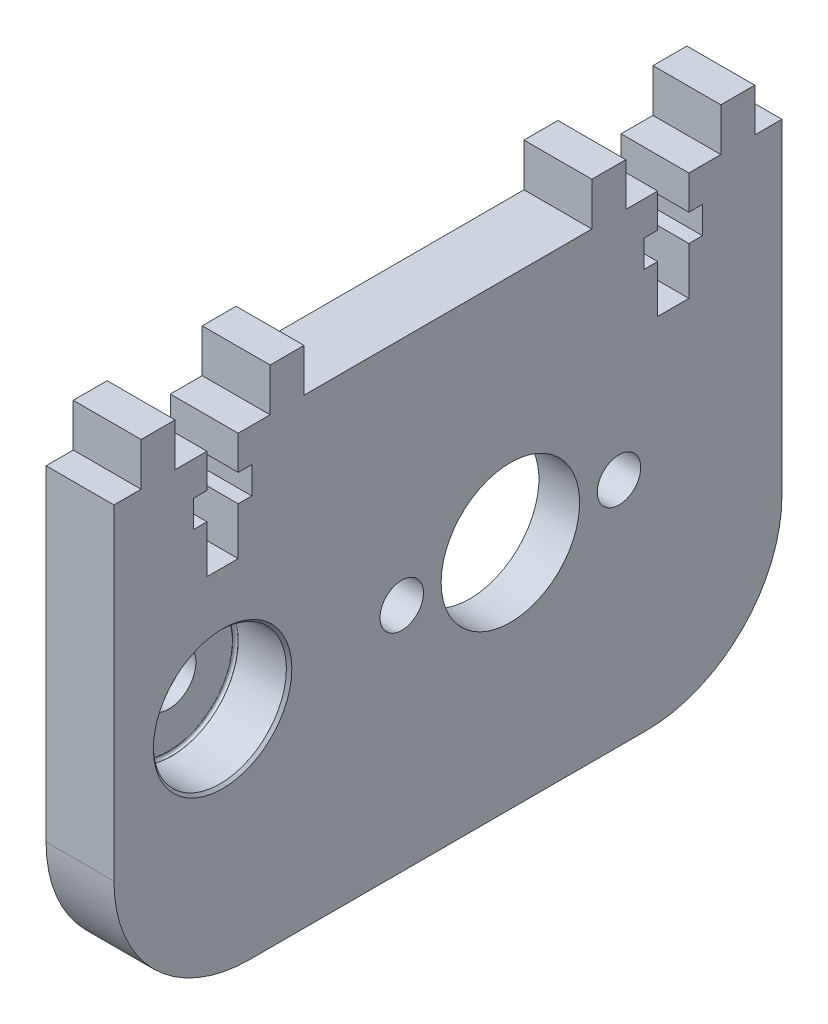
from build123d import *

# Parameters (mm, degrees)
BOSS_EXTRUDE1_DEPTH = 5
SKETCH2_R           = 13.95
CUT_EXTRUDE1_DEPTH  = 2
SKETCH3_R           = 4.9
CUT_EXTRUDE2_DEPTH  = 3.9624
CUT_EXTRUDE3_REACH  = 37.618
SKETCH4_R           = 1.6
SKETCH4_R_2         = 5.1
SKETCH5_R           = 2
CUT_EXTRUDE4_DEPTH  = 36.712340147
FILLET1_R           = 10
BOSS_EXTRUDE2_START = 4
BOSS_EXTRUDE2_DEPTH = 4
FILLET2_R           = 1
CHAMFER1_SIZE       = 0.2
SKETCH7_R           = 0.15
SKETCH10_R          = 0.15


with BuildPart() as part:
    # Sketch1 → Boss-Extrude1 (new body)
    with BuildSketch(Plane(origin=(0, 0, 0), x_dir=(0, 0, -1), z_dir=(1, 0, 0))):
        Polygon((-29.2, 17), (-29.2, -17), (20, -17), (20, 17), (18, 17), (18, 20.175), (15.5, 20.175), (15.5, 17), (13.15, 17), (13.15, 14.5), (14.15, 14.5), (14.15, 12.5), (13.15, 12.5), (13.15, 9), (10.85, 9), (10.85, 12.5), (9.85, 12.5), (9.85, 14.5), (10.85, 14.5), (10.85, 17), (8.5, 17), (8.5, 20.175), (6, 20.175), (6, 17), (-15.2, 17), (-15.2, 20.175), (-17.7, 20.175), (-17.7, 17), (-20.05, 17), (-20.05, 14.5), (-19.05, 14.5), (-19.05, 12.5), (-20.05, 12.5), (-20.05, 9), (-22.35, 9), (-22.35, 12.5), (-23.35, 12.5), (-23.35, 14.5), (-22.35, 14.5), (-22.35, 17), (-24.7, 17), (-24.7, 20.175), (-27.2, 20.175), (-27.2, 17), align=None)
    extrude(amount=BOSS_EXTRUDE1_DEPTH)

    # Sketch2 → Cut-Extrude1 (cut)
    with BuildSketch(Plane.ZY):
        Circle(SKETCH2_R)
    extrude(amount=-CUT_EXTRUDE1_DEPTH, mode=Mode.SUBTRACT)

    # Sketch3 → Cut-Extrude2 (cut)
    with BuildSketch(Plane(origin=(5, 0, 0), x_dir=(0, 0, -1), z_dir=(1, 0, 0))):
        with Locations((-21.2, 0)):
            Circle(SKETCH3_R)
    extrude(amount=-CUT_EXTRUDE2_DEPTH, mode=Mode.SUBTRACT)

    # Sketch4 → Cut-Extrude3 (cut, up to next)
    with BuildSketch(Plane.ZY.offset(-2), mode=Mode.PRIVATE) as cut_extrude3_sk1:
        with Locations((-8, 0)):
            Circle(SKETCH4_R)
    cut_extrude3_tool1 = extrude(cut_extrude3_sk1.sketch, amount=-CUT_EXTRUDE3_REACH, mode=Mode.PRIVATE) & part.part
    # Sketch4 → Cut-Extrude3 (cut, up to next)
    with BuildSketch(Plane.ZY.offset(-2), mode=Mode.PRIVATE) as cut_extrude3_sk2:
        with Locations((8, 0)):
            Circle(SKETCH4_R)
    cut_extrude3_tool2 = extrude(cut_extrude3_sk2.sketch, amount=-CUT_EXTRUDE3_REACH, mode=Mode.PRIVATE) & part.part
    # Sketch4 → Cut-Extrude3 (cut, up to next)
    with BuildSketch(Plane.ZY.offset(-2), mode=Mode.PRIVATE) as cut_extrude3_sk3:
        Circle(SKETCH4_R_2)
    cut_extrude3_tool3 = extrude(cut_extrude3_sk3.sketch, amount=-CUT_EXTRUDE3_REACH, mode=Mode.PRIVATE) & part.part
    add(cut_extrude3_tool1.solids().sort_by_distance((2, 0, -8))[0], mode=Mode.SUBTRACT)
    add(cut_extrude3_tool2.solids().sort_by_distance((2, 0, 8))[0], mode=Mode.SUBTRACT)
    add(cut_extrude3_tool3.solids().sort_by_distance((2, 0, 0))[0], mode=Mode.SUBTRACT)

    # Sketch5 → Cut-Extrude4 (cut, through all)
    with BuildSketch(Plane(origin=(1.0376, 0, 0), x_dir=(0, 0, -1), z_dir=(1, 0, 0))):
        with Locations((-21.2, 0)):
            Circle(SKETCH5_R)
    extrude(amount=-CUT_EXTRUDE4_DEPTH, mode=Mode.SUBTRACT)

    # Fillet1
    fillet1_edges = [part.edges().sort_by_distance(p)[0] for p in [
        (2.5, -17, -20),
        (2.5, -17, 29.2),
    ]]
    fillet(fillet1_edges, radius=FILLET1_R)

    # Sketch6 → Boss-Extrude2 (add)
    with BuildSketch(Plane.ZY.offset(BOSS_EXTRUDE2_START)):
        with BuildLine():
            Line((-5, -13.02315246), (-5, -17))
            Line((-5, -17), (5, -17))
            Line((5, -17), (5, -13.02315246))
            ThreePointArc((5, -13.02315246), (0, -13.95), (-5, -13.02315246))
        make_face()
    extrude(amount=-BOSS_EXTRUDE2_DEPTH)

    # Fillet2
    fillet2_edges = [part.edges().sort_by_distance(p)[0] for p in [
        (-2, -13.02315246, 5),
        (-2, -13.02315246, -5),
        (-4, -17, 0),
        (-2, -17, 5),
        (-2, -17, -5),
    ]]
    fillet(fillet2_edges, radius=FILLET2_R)

    # Chamfer1
    chamfer1_edges = [part.edges().sort_by_distance(p)[0] for p in [
        (5, 0, 26.1),
    ]]
    chamfer(chamfer1_edges, length=CHAMFER1_SIZE)

    # Sketch7 → Cut-Revolve1 (revolve, cut)
    with BuildSketch(Plane(origin=(0, 0, 0), x_dir=(1, 0, 0), z_dir=(0, 1, 0))):
        with Locations((1.9, -13.85)):
            Circle(SKETCH7_R)
    revolve(axis=Axis((5, 0, 0), (-1, 0, 0)), mode=Mode.SUBTRACT)

    # Sketch10 → Cut-Revolve2 (revolve, cut)
    with BuildSketch(Plane(origin=(0, 0, 0), x_dir=(1, 0, 0), z_dir=(0, 1, 0))):
        with Locations((1.1376, -16.4)):
            Circle(SKETCH10_R)
    revolve(axis=Axis((0, 0, 21.2), (1, 0, 0)), mode=Mode.SUBTRACT)


solid = part.part
